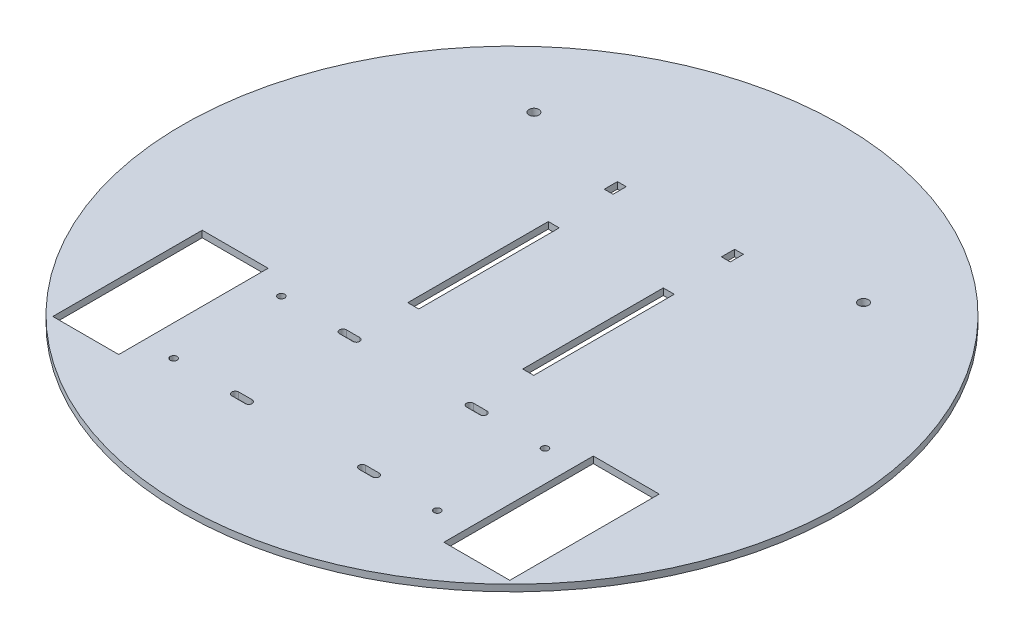
from build123d import *

# Parameters (mm, degrees)
BOSS_EXTRUDE1_OUTLINE_R   = 150
BOSS_EXTRUDE1_OUTLINE_R_2 = 1.55
BOSS_EXTRUDE1_OUTLINE_W   = 30
BOSS_EXTRUDE1_OUTLINE_H   = 68
BOSS_EXTRUDE1_OUTLINE_R_3 = 2.25
BOSS_EXTRUDE1_DEPTH       = 3
SKETCH3_W                 = 5
SKETCH3_H                 = 63.96
SKETCH3_W_2               = 4
SKETCH3_H_2               = 6
CUT_EXTRUDE1_DEPTH        = 10


# Read off the part's stored shape, not the designer's step: Boss-Extrude1
with BuildPart() as part:
    # Boss-Extrude1 outline → Boss-Extrude1 (new body)
    with BuildSketch(Plane(origin=(0, 0, 0), x_dir=(1, 0, 0), z_dir=(0, 1, 0))):
        Circle(BOSS_EXTRUDE1_OUTLINE_R)
        with Locations((-60, -94)):
            Circle(BOSS_EXTRUDE1_OUTLINE_R_2, mode=Mode.SUBTRACT)
        with BuildLine():
            Line((-25.85, -95.55), (-31.95, -95.55))
            ThreePointArc((-31.95, -95.55), (-33.5, -94), (-31.95, -92.45))
            Line((-31.95, -92.45), (-25.85, -92.45))
            ThreePointArc((-25.85, -92.45), (-24.3, -94), (-25.85, -95.55))
        make_face(mode=Mode.SUBTRACT)
        with Locations((-89, -71)):
            Rectangle(BOSS_EXTRUDE1_OUTLINE_W, BOSS_EXTRUDE1_OUTLINE_H, mode=Mode.SUBTRACT)
        with Locations((-60, -45)):
            Circle(BOSS_EXTRUDE1_OUTLINE_R_2, mode=Mode.SUBTRACT)
        with BuildLine():
            Line((-25.85, -46.55), (-31.95, -46.55))
            ThreePointArc((-31.95, -46.55), (-33.5, -45), (-31.95, -43.45))
            Line((-31.95, -43.45), (-25.85, -43.45))
            ThreePointArc((-25.85, -43.45), (-24.3, -45), (-25.85, -46.55))
        make_face(mode=Mode.SUBTRACT)
        with BuildLine():
            Line((25.85, -92.45), (31.95, -92.45))
            ThreePointArc((31.95, -92.45), (33.5, -94), (31.95, -95.55))
            Line((31.95, -95.55), (25.85, -95.55))
            ThreePointArc((25.85, -95.55), (24.3, -94), (25.85, -92.45))
        make_face(mode=Mode.SUBTRACT)
        with Locations((60, -94)):
            Circle(BOSS_EXTRUDE1_OUTLINE_R_2, mode=Mode.SUBTRACT)
        with BuildLine():
            Line((25.85, -43.45), (31.95, -43.45))
            ThreePointArc((31.95, -43.45), (33.5, -45), (31.95, -46.55))
            Line((31.95, -46.55), (25.85, -46.55))
            ThreePointArc((25.85, -46.55), (24.3, -45), (25.85, -43.45))
        make_face(mode=Mode.SUBTRACT)
        with Locations((60, -45)):
            Circle(BOSS_EXTRUDE1_OUTLINE_R_2, mode=Mode.SUBTRACT)
        with Locations((89, -71)):
            Rectangle(BOSS_EXTRUDE1_OUTLINE_W, BOSS_EXTRUDE1_OUTLINE_H, mode=Mode.SUBTRACT)
        with Locations((-75, 85)):
            Circle(BOSS_EXTRUDE1_OUTLINE_R_3, mode=Mode.SUBTRACT)
        with Locations((75, 85)):
            Circle(BOSS_EXTRUDE1_OUTLINE_R_3, mode=Mode.SUBTRACT)
    extrude(amount=BOSS_EXTRUDE1_DEPTH)

    # Sketch3 → Cut-Extrude1 (cut)
    with BuildSketch(Plane(origin=(0, 3, 0), x_dir=(1, 0, 0), z_dir=(0, 1, 0))):
        with Locations((-26.17, 13.2)):
            Rectangle(SKETCH3_W, SKETCH3_H)
        with Locations((-26.67, 73.66)):
            Rectangle(SKETCH3_W_2, SKETCH3_H_2)
        with Locations((26.67, 73.66)):
            Rectangle(SKETCH3_W_2, SKETCH3_H_2)
        with Locations((26.17, 13.2)):
            Rectangle(SKETCH3_W, SKETCH3_H)
    extrude(amount=-CUT_EXTRUDE1_DEPTH, mode=Mode.SUBTRACT)


solid = part.part
